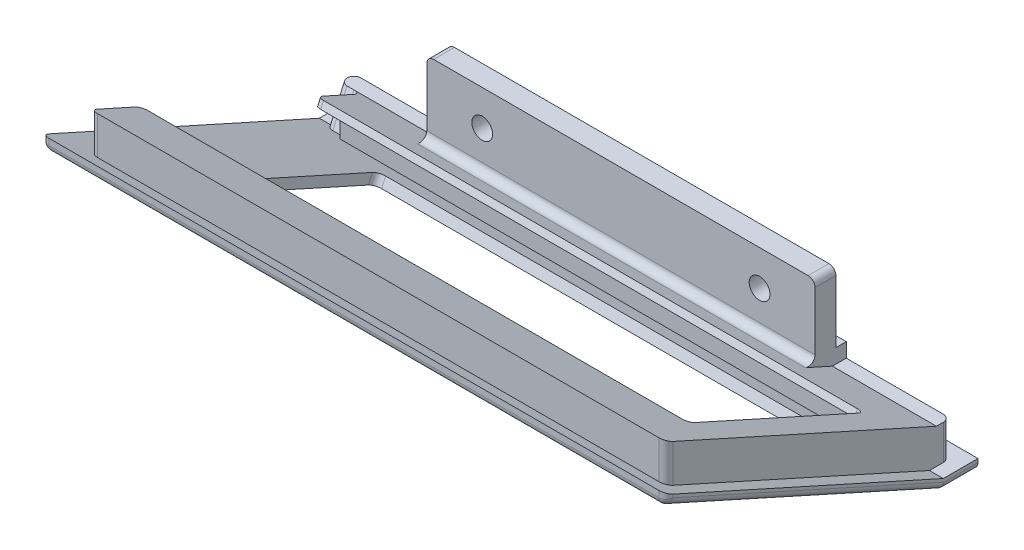
from build123d import *

# Parameters (mm, degrees)
SKETCH_1_W               = 90
SKETCH_1_H               = 45
EXTRUDE_1_DEPTH          = 60
CUT_EXTRUDE_1_DEPTH      = 118.153745139
CUT_EXTRUDE_1_DEPTH_BACK = 118.153745139
CUT_EXTRUDE_2_DEPTH      = 105.446158378
EXTRUDE_3_REACH          = 105.804
SKETCH_4_W               = 86
SKETCH_4_H               = 41
SKETCH_4_W_2             = 82
SKETCH_4_H_2             = 34
CUT_EXTRUDE_3_DEPTH      = 105.522724802
SKETCH_6_W               = 72
SKETCH_6_H               = 33
CUT_EXTRUDE_4_DEPTH      = 98.541192544
EXTRUDE_8_DEPTH          = 82
CUT_EXTRUDE_5_REACH      = 99.614
SKETCH_10_W              = 79
SKETCH_10_H              = 27.766838789
SKETCH_11_W              = 3
SKETCH_11_H              = 42.766838789
CUT_EXTRUDE_6_DEPTH      = 5
EXTRUDE_9_DEPTH          = 28
SKETCH_13_R              = 1.5
CUT_EXTRUDE_7_DEPTH      = 104.169264805
FILLET_1_R               = 1
FILLET_2_R               = 1
FILLET_3_R               = 1
CUT_EXTRUDE_8_DEPTH      = 1


with BuildPart() as part:
    # 草图1 → 凸台-拉伸1 (new body)
    with BuildSketch(Plane(origin=(0, 0, 0), x_dir=(1, 0, 0), z_dir=(0, 1, 0))):
        with Locations((45, 22.5)):
            Rectangle(SKETCH_1_W, SKETCH_1_H)
    extrude(amount=EXTRUDE_1_DEPTH)

    # 草图2 → 切除-拉伸1 (cut, two sides: drawn at the far end of the back side and taken through both)
    with BuildSketch(Plane(origin=(90, 0, 0), x_dir=(0, 0, -1), z_dir=(1, 0, 0)).offset(-CUT_EXTRUDE_1_DEPTH_BACK)):
        Polygon((0, 220), (0, 60), (0, 28), (40, 10), (45, 10), (205, 10), (433.983745882, 233.531751932), (228.983745882, 443.531751932), align=None)
    extrude(amount=CUT_EXTRUDE_1_DEPTH + CUT_EXTRUDE_1_DEPTH_BACK, mode=Mode.SUBTRACT)

    # 草图3 → 切除-拉伸2 (cut, through all)
    with BuildSketch(Plane(origin=(90, 0, 0), x_dir=(0, 0, -1), z_dir=(1, 0, 0))):
        Polygon((0, 26.44865757), (39.885905712, 8.5), (45, 8.5), (45, 0), (0, 0), align=None)
    extrude(amount=-CUT_EXTRUDE_2_DEPTH, mode=Mode.SUBTRACT)

    # 草图4 → 凸台-拉伸3 (add, up to next)
    with BuildSketch(Plane(origin=(0, 34, 0), x_dir=(1, 0, 0), z_dir=(0, 1, 0)), mode=Mode.PRIVATE) as extrude_3_sk1:
        with Locations((45, 22.5)):
            Rectangle(SKETCH_4_W, SKETCH_4_H)
        with Locations((45, 21)):
            Rectangle(SKETCH_4_W_2, SKETCH_4_H_2, mode=Mode.SUBTRACT)
    extrude_3_tool1 = extrude(extrude_3_sk1.sketch, amount=-EXTRUDE_3_REACH, mode=Mode.PRIVATE) - part.part
    add(extrude_3_tool1.solids().sort_by_distance((45, 34, -2.952733))[0])

    # 草图5 → 切除-拉伸3 (cut, through all)
    with BuildSketch(Plane.ZY.offset(-2)):
        Polygon((-43, 15.03292805), (-41, 15.03292805), (-2, 32.58292805), (-2, 34), (-43, 34), align=None)
    extrude(amount=-CUT_EXTRUDE_3_DEPTH, mode=Mode.SUBTRACT)

    # 草图6 → 切除-拉伸4 (cut, through all)
    with BuildSketch(Plane(origin=(0, 21.99472563, -9.897626534), x_dir=(1, 0, 0), z_dir=(0, -0.9119215051751064, 0.41036467732879806))):
        with Locations((49, -11.015560293)):
            Rectangle(SKETCH_6_W, SKETCH_6_H)
    extrude(amount=-CUT_EXTRUDE_4_DEPTH, mode=Mode.SUBTRACT)

    # 草图9 → 凸台-拉伸8 (add)
    with BuildSketch(Plane(origin=(4, 0, 0), x_dir=(0, 0, -1), z_dir=(1, 0, 0))):
        Polygon((4, 31.68292805), (4, 30.58634244), (38, 15.28634244), (38, 16.38292805), align=None)
    extrude(amount=EXTRUDE_8_DEPTH)

    # 草图10 → 切除-拉伸5 (cut, up to next)
    with BuildSketch(Plane(origin=(0, 27.844430811, -12.529993865), x_dir=(1, 0, 0), z_dir=(0, 0.9119215051751064, -0.410364677328798)), mode=Mode.PRIVATE) as cut_extrude_5_sk1:
        with Locations((44.5, 10.33637965)):
            Rectangle(SKETCH_10_W, SKETCH_10_H)
    cut_extrude_5_tool1 = extrude(cut_extrude_5_sk1.sketch, amount=-CUT_EXTRUDE_5_REACH, mode=Mode.PRIVATE) & part.part
    add(cut_extrude_5_tool1.solids().sort_by_distance((44.5, 23.602746, -21.955961))[0], mode=Mode.SUBTRACT)

    # 草图11 → 切除-拉伸6 (cut)
    with BuildSketch(Plane(origin=(0, 27.844430811, -12.529993865), x_dir=(1, 0, 0), z_dir=(0, 0.9119215051751064, -0.410364677328798))):
        with Locations((3.5, 9.836379649)):
            Rectangle(SKETCH_11_W, SKETCH_11_H)
    extrude(amount=-CUT_EXTRUDE_6_DEPTH, mode=Mode.SUBTRACT)

    # 草图12 → 凸台-拉伸9 (add, symmetric)
    with BuildSketch(Plane(origin=(45, 0, 0), x_dir=(0, 0, -1), z_dir=(1, 0, 0))):
        Polygon((43, 15.03292805), (43, 17.095415955), (41.5, 17.095415955), (41.5, 27.095415955), (38.5, 27.095415955), (38.5, 15.06134244), (41, 15.03292805), align=None)
    extrude(amount=EXTRUDE_9_DEPTH, both=True)

    # 草图13 → 切除-拉伸7 (cut, through all)
    with BuildSketch(Plane.XY.offset(-38.5)):
        with Locations((25, 22)):
            Circle(SKETCH_13_R)
        with Locations((65, 22)):
            Circle(SKETCH_13_R)
    extrude(amount=-CUT_EXTRUDE_7_DEPTH, mode=Mode.SUBTRACT)

    # 圆角1
    fillet_1_edges = [part.edges().sort_by_distance(p)[0] for p in [
        (13, 11.348360437, -35.279929664),
        (13, 24.890394788, -5.186519993),
        (85, 24.890394788, -5.186519993),
        (85, 11.348360437, -35.279929664),
        (90, 27.224328785, 0),
        (0, 27.224328785, 0),
        (0, 17.474328785, -19.942952856),
        (45, 26.44865757, 0),
        (0, 8.5, -42.442952856),
        (45, 8.5, -39.885905712),
        (90, 8.5, -42.442952856),
        (90, 17.474328785, -19.942952856),
    ]]
    fillet(fillet_1_edges, radius=FILLET_1_R)

    # 圆角2
    fillet_2_edges = [part.edges().sort_by_distance(p)[0] for p in [
        (45, 16.15792805, -38.5),
        (73, 27.095415955, -40),
        (17, 27.095415955, -40),
    ]]
    fillet(fillet_2_edges, radius=FILLET_2_R)

    # 圆角3
    # the kernel refuses this fillet: 1 mm, written as the material it adds along each edge
    with BuildSketch(Plane(origin=(84, 29.300010631, -9.295372041), x_dir=(0, -0.4103646773287979, -0.9119215051751064), z_dir=(0, -0.9119215051751064, 0.41036467732879794)), Plane(origin=(84, 17.905480791, -34.616549464), x_dir=(-1, 0, 0), z_dir=(0, -0.9119215051751064, 0.41036467732879794))) as fillet_3_piece_1:
        with BuildLine():
            CenterArc((FILLET_3_R, -FILLET_3_R), FILLET_3_R, 90, 90)
            Line((0, -FILLET_3_R), (0, 0))
            Line((0, 0), (FILLET_3_R, 0))
        make_face()
    extrude(amount=1)
    with BuildSketch(Plane(origin=(5, 15.03292805, -41), x_dir=(-1, 0, 0), z_dir=(0, -0.9119215051751064, 0.410364677328798))) as fillet_3_piece_2_section:
        with BuildLine():
            CenterArc((FILLET_3_R, -FILLET_3_R), FILLET_3_R, 90, 90)
            Line((0, -FILLET_3_R), (0, 0))
            Line((0, 0), (FILLET_3_R, 0))
        make_face()
    fillet_3_piece_2 = extrude(amount=7.5, mode=Mode.PRIVATE)
    fillet_3_piece_2 = split(fillet_3_piece_2, bisect_by=Plane(origin=(4.869229562, 9.339477608, -38.020399916), z_dir=(0, 0.9119215051751064, -0.41036467732879794)), keep=Keep.TOP, mode=Mode.PRIVATE)
    add(fillet_3_piece_2)
    # the kernel refuses this fillet: 1 mm, written as the material it takes off along each edge
    with BuildSketch(Plane(origin=(88, 17.53292805, -43), x_dir=(-1, 0, 0), z_dir=(0, -1, 0))) as fillet_3_2_piece_1:
        with BuildLine():
            CenterArc((FILLET_3_R, -FILLET_3_R), FILLET_3_R, 90, 90)
            Line((0, -FILLET_3_R), (0, 0))
            Line((0, 0), (FILLET_3_R, 0))
        make_face()
    extrude(amount=7.53292805, mode=Mode.SUBTRACT)
    with BuildSketch(Plane(origin=(2, 17.53292805, -43), x_dir=(1, 0, 0), z_dir=(0, -1, 0))) as fillet_3_2_piece_2:
        with BuildLine():
            CenterArc((FILLET_3_R, FILLET_3_R), FILLET_3_R, 180, 90)
            Line((0, FILLET_3_R), (0, 0))
            Line((0, 0), (FILLET_3_R, 0))
        make_face()
    extrude(amount=7.53292805, mode=Mode.SUBTRACT)
    with BuildSketch(Plane(origin=(5, 31.579814394, -10.321283735), x_dir=(1, 0, 0), z_dir=(0, -0.9119215051751064, 0.41036467732879794)), Plane(origin=(5, 20.185284554, -35.642461157), x_dir=(0, -0.4103646773287979, -0.9119215051751064), z_dir=(0, -0.9119215051751064, 0.41036467732879794))) as fillet_3_2_piece_3:
        with BuildLine():
            CenterArc((FILLET_3_R, FILLET_3_R), FILLET_3_R, 180, 90)
            Line((0, FILLET_3_R), (0, 0))
            Line((0, 0), (FILLET_3_R, 0))
        make_face()
    extrude(amount=6, mode=Mode.SUBTRACT)
    with BuildSketch(Plane(origin=(2, 17.312731813, -42.025911693), x_dir=(0, -0.410364677328798, -0.9119215051751063), z_dir=(0, -0.9119215051751064, 0.410364677328798))) as fillet_3_2_piece_4:
        with BuildLine():
            CenterArc((FILLET_3_R, FILLET_3_R), FILLET_3_R, 180, 90)
            Line((0, FILLET_3_R), (0, 0))
            Line((0, 0), (FILLET_3_R, 0))
        make_face()
    extrude(amount=7.5, mode=Mode.SUBTRACT)
    with BuildSketch(Plane(origin=(5, 35.08292805, -2), x_dir=(0, 0, -1), z_dir=(0, -1, 0))) as fillet_3_2_piece_5_section:
        with BuildLine():
            CenterArc((FILLET_3_R, FILLET_3_R), FILLET_3_R, 180, 90)
            Line((0, FILLET_3_R), (0, 0))
            Line((0, 0), (FILLET_3_R, 0))
        make_face()
    fillet_3_2_piece_5 = extrude(amount=10.48292805, mode=Mode.PRIVATE)
    fillet_3_2_piece_5 = split(fillet_3_2_piece_5, bisect_by=Plane(origin=(5.223367939, 27.46114469, -1.197456246), z_dir=(0, 0.9119215051751064, -0.4103646773287979)), keep=Keep.TOP, mode=Mode.PRIVATE)
    add(fillet_3_2_piece_5, mode=Mode.SUBTRACT)
    with BuildSketch(Plane(origin=(88, 35.08292805, -2), x_dir=(-1, 0, 0), z_dir=(0, -1, 0))) as fillet_3_2_piece_6_section:
        with BuildLine():
            CenterArc((FILLET_3_R, FILLET_3_R), FILLET_3_R, 180, 90)
            Line((0, FILLET_3_R), (0, 0))
            Line((0, 0), (FILLET_3_R, 0))
        make_face()
    fillet_3_2_piece_6 = extrude(amount=10.48292805, mode=Mode.PRIVATE)
    fillet_3_2_piece_6 = split(fillet_3_2_piece_6, bisect_by=Plane(origin=(87.776632061, 27.46114469, -1.197456246), z_dir=(0, 0.9119215051751064, -0.4103646773287979)), keep=Keep.TOP, mode=Mode.PRIVATE)
    add(fillet_3_2_piece_6, mode=Mode.SUBTRACT)

    # 草图14 → 切除-拉伸8 (cut)
    with BuildSketch(Plane(origin=(0, 21.99472563, -9.897626534), x_dir=(1, 0, 0), z_dir=(0, -0.9119215051751063, 0.4103646773287981))):
        with BuildLine():
            Line((9, 3.984439707), (9, -26.015560293))
            ThreePointArc((9, -26.015560293), (8, -27.015560293), (7, -26.015560293))
            Line((7, -26.015560293), (7, 3.984439707))
            ThreePointArc((7, 3.984439707), (8, 4.984439707), (9, 3.984439707))
        make_face()
        with BuildLine():
            Line((3, -1.015560293), (3, 3.984439707))
            ThreePointArc((3, 3.984439707), (4, 4.984439707), (5, 3.984439707))
            Line((5, 3.984439707), (5, -1.015560293))
            ThreePointArc((5, -1.015560293), (4, -2.015560293), (3, -1.015560293))
        make_face()
    extrude(amount=-CUT_EXTRUDE_8_DEPTH, mode=Mode.SUBTRACT)


solid = part.part
